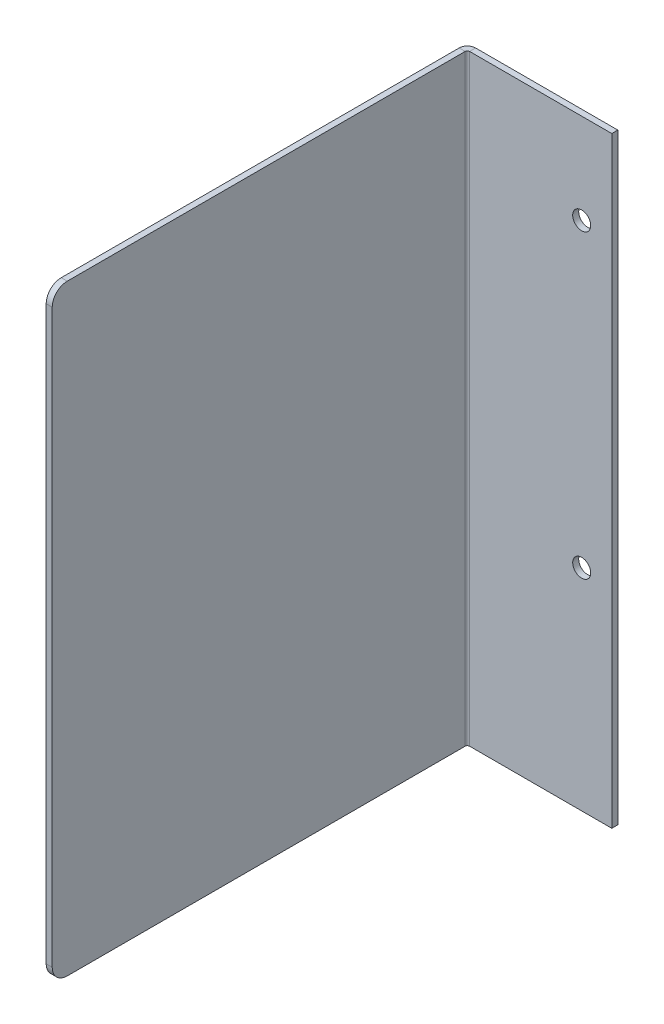
from build123d import *

# Parameters (mm, degrees)
SKETCH_1_W                       = 50
SKETCH_1_H                       = 200
SM_BASE_FLANGE_1_DEPTH           = 2
SM_EDGE_FLANGE_1_STRIP_W         = 9.4732
SM_EDGE_FLANGE_1_STRIP_H         = 2
SM_EDGE_FLANGE_1_STRIP_CUT_DEPTH = 200
SM_EDGE_FLANGE_1_DEPTH           = 200
SKETCH_8_R                       = 3
CUT_EXTRUDE_1_DEPTH              = 10
PATTERN_LINEAR_1_COUNT           = 2
PATTERN_LINEAR_1_PITCH           = 100
FILLET_2_R                       = 5
FILLET_3_R                       = 5


# Sheet-metal steps are written as plain solids
with BuildPart() as part:
    # Sketch 1 → 基体-法兰1 (new body)
    with BuildSketch(Plane.XY):
        with Locations((16.662404092, -92.250639386)):
            Rectangle(SKETCH_1_W, SKETCH_1_H)
    extrude(amount=-SM_BASE_FLANGE_1_DEPTH)

    # 边线-法兰1 strip (across the edge) → 边线-法兰1 strip cut (cut)
    with BuildSketch(Plane(origin=(-8.337595908, 7.749360614, 0), x_dir=(1, 0, 0), z_dir=(0, -1, 0))):
        with Locations((-2, -1)):
            Rectangle(SM_EDGE_FLANGE_1_STRIP_W, SM_EDGE_FLANGE_1_STRIP_H)
    extrude(amount=SM_EDGE_FLANGE_1_STRIP_CUT_DEPTH, mode=Mode.SUBTRACT)

    # 边线-法兰1 section (across the edge) → 边线-法兰1 (add)
    with BuildSketch(Plane(origin=(-8.337595908, 7.749360614, 0), x_dir=(1, 0, 0), z_dir=(0, -1, 0))):
        with BuildLine():
            Line((0, 0.7366), (0, 138))
            Line((0, 138), (2, 138))
            Line((2, 138), (2, 0.7366))
            ThreePointArc((2, 0.7366), (2.215745145, 0.215745145), (2.7366, 0))
            Line((2.7366, 0), (2.7366, -2))
            ThreePointArc((2.7366, -2), (0.801531583, -1.198468417), (0, 0.7366))
        make_face()
    extrude(amount=SM_EDGE_FLANGE_1_DEPTH)

    # 草图8 → 切除-拉伸1 (cut)
    with BuildSketch(Plane.XY):
        with Locations((31.662404092, -22.250639386)):
            Circle(SKETCH_8_R)
    cut_extrude_1 = extrude(amount=-CUT_EXTRUDE_1_DEPTH, mode=Mode.SUBTRACT)

    # 阵列(线性)1: 切除-拉伸1 ×2
    with Locations(*[(0, -i * PATTERN_LINEAR_1_PITCH, 0) for i in range(1, PATTERN_LINEAR_1_COUNT)]):
        add(cut_extrude_1, mode=Mode.SUBTRACT)

    # 圆角2
    fillet_2_edges = [part.edges().sort_by_distance(p)[0] for p in [
        (-7.337595908, 7.749360614, 138),
    ]]
    fillet(fillet_2_edges, radius=FILLET_2_R)

    # 圆角3
    fillet_3_edges = [part.edges().sort_by_distance(p)[0] for p in [
        (-7.337595908, -192.250639386, 138),
    ]]
    fillet(fillet_3_edges, radius=FILLET_3_R)


solid = part.part
